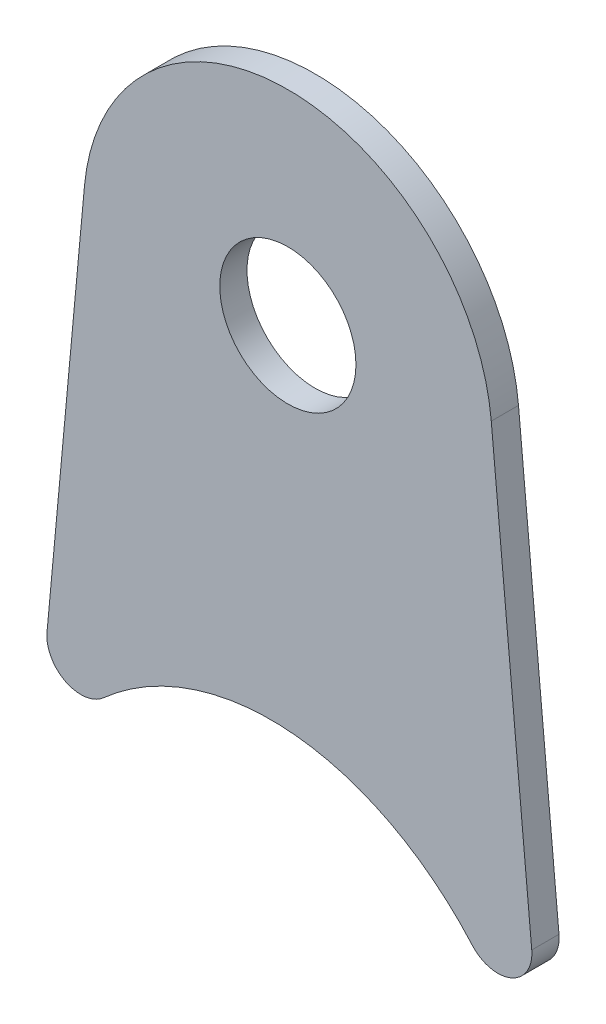
from build123d import *

# Parameters (mm, degrees)
SKETCH1_R           = 3.175
BOSS_EXTRUDE1_DEPTH = 0.635
SKETCH2_R           = 12.7
CUT_EXTRUDE4_DEPTH  = 212.524238452
CUT_EXTRUDE5_DEPTH  = 37.22284017
FILLET1_R           = 1.5875


with BuildPart() as part:
    # Sketch1 → Boss-Extrude1 (new, symmetric)
    with BuildSketch(Plane.XY):
        with BuildLine():
            Line((-9.484545184, 0.876942223), (-12.7, -33.89972345))
            Line((-12.7, -33.89972345), (12.7, -33.89972345))
            Line((12.7, -33.89972345), (9.484545184, 0.876942223))
            ThreePointArc((9.484545184, 0.876942223), (0, 9.525), (-9.484545184, 0.876942223))
        make_face()
        Circle(SKETCH1_R, mode=Mode.SUBTRACT)
    extrude(amount=BOSS_EXTRUDE1_DEPTH, both=True)

    # Sketch2 → Cut-Extrude4 (cut, through all)
    with BuildSketch(Plane(origin=(11.360273025, -110.358999973, -171.966950351), x_dir=(0.9980881037002614, 0.025903655155534222, 0.05611718009308436), z_dir=(-0.06180716474340577, 0.4198866087842844, 0.9054695523042258))):
        Circle(SKETCH2_R)
    extrude(amount=CUT_EXTRUDE4_DEPTH, mode=Mode.SUBTRACT)


with BuildPart() as cut_extrude4_kept_piece:
    # of the separate pieces the step leaves, the one the design keeps (cut_extrude4_pieces_kept)
    add(part.part.solids().sort_by_distance((-9.484545184, 0.876942223, 0.635))[0])

    # Sketch3 → Cut-Extrude5 (cut, through all)
    with BuildSketch(Plane.XY.offset(0.635)):
        with BuildLine():
            Line((-11.744890387, -23.569760946), (-12.986106665, -32.169096948))
            Line((-12.986106665, -32.169096948), (12.819749994, -35.194876316))
            Line((12.819749994, -35.194876316), (11.371919396, -19.535903157))
            ThreePointArc((11.371919396, -19.535903157), (10.419687683, -21.139836428), (8.599708374, -20.731152577))
            add(Edge.make_bspline(
                [(8.599708374, -20.731152577), (-3.74867157, -6.707106034), (-11.744890387, -23.569760946)],
                knots=[2.192806487, 2.192806487, 2.192806487, 4.076762859, 4.076762859, 4.076762859], degree=2, weights=[1, 0.588189372, 1]))
        make_face()
    extrude(amount=-CUT_EXTRUDE5_DEPTH, mode=Mode.SUBTRACT)

    # Fillet1
    fillet1_edges = [cut_extrude4_kept_piece.edges().sort_by_distance(p)[0] for p in [
        (-11.744890387, -23.569760946, 0),
    ]]
    fillet(fillet1_edges, radius=FILLET1_R)


solid = cut_extrude4_kept_piece.part
